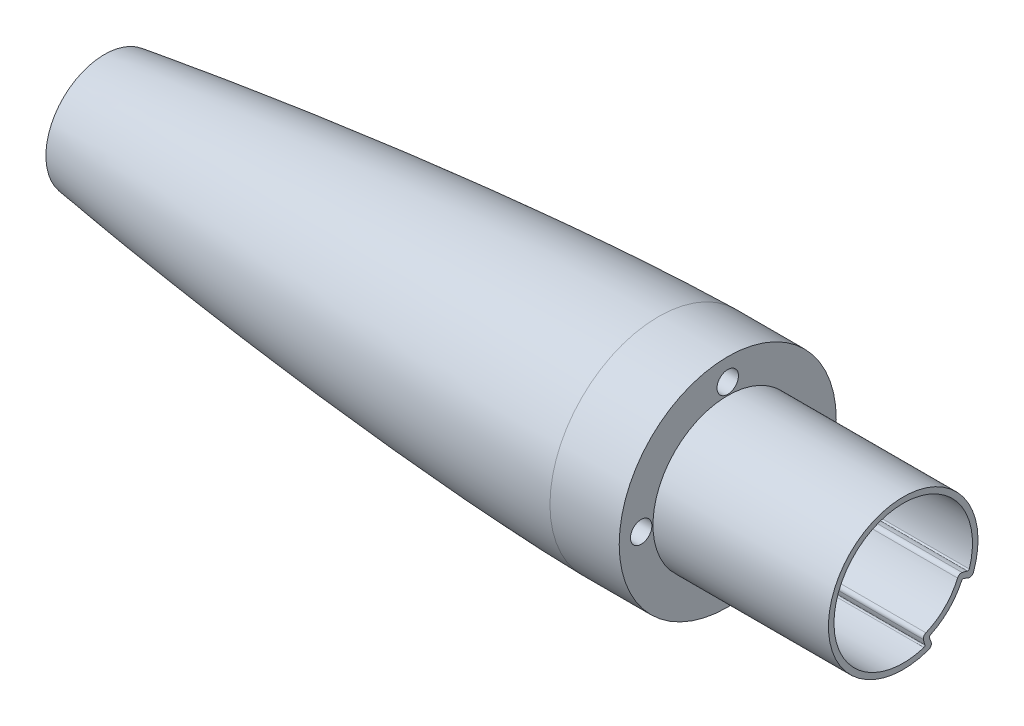
from build123d import *

# Parameters (mm, degrees)
CUT_EXTRUDE1_DEPTH = 400
SKETCH3_R          = 33
SKETCH3_R_2        = 3.1000000000000028
CUT_EXTRUDE2_DEPTH = 40
SKETCH3_2_R        = 3.1000000000000028
CUT_EXTRUDE4_DEPTH = 588.2704126987336
SKETCH4_R          = 7.750000000000002
SKETCH4_R_2        = 7.749999999999998
SKETCH4_R_3        = 7.75
CUT_EXTRUDE5_DEPTH = 30
CUT_EXTRUDE6_START = -166.72
CUT_EXTRUDE6_DEPTH = 166.72
CUT_EXTRUDE7_START = -166.72
CUT_EXTRUDE7_DEPTH = 40
FILLET1_R          = 3
FILLET2_R          = 1


# Read off the part's stored shape, not the designer's step: Cut-Extrude7
with BuildPart() as part:
    # Sketch1 → Revolve1 (revolve)
    with BuildSketch(Plane.XY, mode=Mode.PRIVATE) as revolve1_sk:
        with BuildLine():
            Line((650.0000000000001, 78.36), (600.0000000000001, 78.35999999999999))
            add(Edge.make_bspline(
                [(200.00000000000358, 42.32828037010144), (208.17052038042252, 43.51395402277683), (225.68488706430128, 45.99527814756255), (252.5646252490451, 49.61720291886234), (288.8377795121088, 54.154525537406215), (326.32073414086074, 58.489281573967666), (363.84117713275197, 62.4863121261995), (401.3959942076804, 66.1465092198773), (438.98297125108434, 69.46060873551288), (476.60065297069735, 72.40710938265987), (509.54226569024473, 74.62869781075653), (537.7964811389767, 76.23350465282824), (560.2922621801154, 77.27545940077594), (575.1953567037801, 77.83264328043563), (587.2142250450652, 78.17300672656529), (594.5199761893905, 78.31035588184413), (598.173256760109, 78.35432466011183), (600.0000000000001, 78.35999999999999)],
                knots=[0.33782774337518406, 0.33782774337518406, 0.33782774337518406, 0.33782774337518406, 0.33782774337518406, 0.3922467059008778, 0.45442341660838875, 0.5166001272068571, 0.5787768404127641, 0.6409535517353824, 0.7031302632972144, 0.7653069754242735, 0.8274836869805778, 0.8896603985814769, 0.9207487548355946, 0.9518371110897123, 0.9759185555448562, 0.9879592777724281, 1, 1, 1, 1, 1], degree=4))
            Line((200.0000000000036, 42.32828037010143), (200, -7.43e-14))
            Line((200, 0), (776.72, 0))
            Line((776.72, 0), (776.72, 54))
            Line((776.72, 54), (650.0000000000001, 54))
            Line((650.0000000000001, 54), (650.0000000000001, 78.36))
        make_face()
    revolve(revolve1_sk.sketch.rotate(Axis((776.72, 0, 0), (-1, 0, 0)), 90), axis=Axis((776.72, 0, 0), (-1, 0, 0)))

    # Sketch2 → Cut-Extrude1 (cut)
    with BuildSketch(Plane(origin=(776.72, 0, 0), x_dir=(0, 0, -1), z_dir=(1, 0, 0))):
        with BuildLine():
            ThreePointArc((47.36738574096539, -16.010333165383813), (-35.35533905932756, 35.35533905932719), (16.01033316538431, -47.367385740965226))
            ThreePointArc((16.010333165384957, -47.36738574096489), (14.843408327061695, -43.77194076139418), (14.25549204864172, -40.03786890496388))
            ThreePointArc((14.25549204864269, -40.03786890496403), (30.05203820042843, -30.05203820042811), (40.037868904964185, -14.255492048642266))
            ThreePointArc((40.03786890496402, -14.255492048641287), (43.77194076139434, -14.843408327061226), (47.36738574096508, -16.01033316538445))
        make_face()
    extrude(amount=-CUT_EXTRUDE1_DEPTH, mode=Mode.SUBTRACT)

    # Sketch3 → Cut-Extrude2 (cut)
    with BuildSketch(Plane.ZY.offset(-200.00000000000273)):
        Circle(SKETCH3_R)
        with Locations((0, 20)):
            Circle(SKETCH3_R_2, mode=Mode.SUBTRACT)
        with Locations((0, -20)):
            Circle(SKETCH3_R_2, mode=Mode.SUBTRACT)
    extrude(amount=-CUT_EXTRUDE2_DEPTH, mode=Mode.SUBTRACT)

    # Sketch3<2> → Cut-Extrude4 (cut, through all)
    with BuildSketch(Plane.ZY.offset(-200.00000000000273)):
        with Locations((0, 20)):
            Circle(SKETCH3_2_R)
        with Locations((0, -20)):
            Circle(SKETCH3_2_R)
    extrude(amount=-CUT_EXTRUDE4_DEPTH, mode=Mode.SUBTRACT)

    # Sketch4 → Cut-Extrude5 (cut)
    with BuildSketch(Plane(origin=(650.0000000000001, 0, 0), x_dir=(0, 0, -1), z_dir=(1, 0, 0))):
        with Locations((0, 62.5)):
            Circle(SKETCH4_R)
        with Locations((62.499999999999986, -2.1825e-13)):
            Circle(SKETCH4_R_2)
        with Locations((-4.3715e-13, -62.5)):
            Circle(SKETCH4_R_3)
        with Locations((-62.49999999999999, 6.5573e-13)):
            Circle(SKETCH4_R_2)
    extrude(amount=-CUT_EXTRUDE5_DEPTH, mode=Mode.SUBTRACT)

    # Sketch2<3> → Cut-Extrude6 (cut)
    with BuildSketch(Plane(origin=(776.72, 0, 0), x_dir=(0, 0, -1), z_dir=(1, 0, 0)).offset(CUT_EXTRUDE6_START)):
        with BuildLine():
            ThreePointArc((18.674162122276517, -42.585510083018875), (19.845504593214095, -46.16550545726443), (21.667324002424465, -49.462380356933224))
            ThreePointArc((21.66732400242451, -49.46238035693348), (38.18376618407376, -38.18376618407337), (49.4623803569337, -21.667324002424003))
            ThreePointArc((49.46238035693346, -21.667324002423932), (46.16550545726464, -19.845504593213597), (42.58551008301907, -18.67416212227606))
            ThreePointArc((42.58551008301935, -18.674162122276265), (32.880465325174626, -32.88046532517429), (18.674162122276698, -42.58551008301916))
        make_face()
    extrude(amount=CUT_EXTRUDE6_DEPTH, mode=Mode.SUBTRACT)

    # Cut-Extrude7 outline → Cut-Extrude7 (cut)
    with BuildSketch(Plane(origin=(776.72, 0, 0), x_dir=(0, 0, -1), z_dir=(1, 0, 0)).offset(CUT_EXTRUDE7_START)):
        with BuildLine():
            ThreePointArc((49.462380357, -21.667324002), (38.183766184, -38.183766184), (21.667324002, -49.462380357))
            ThreePointArc((21.667324002, -49.462380357), (52.325901808, -52.325901808), (49.462380357, -21.667324002))
        make_face()
    extrude(amount=CUT_EXTRUDE7_DEPTH, mode=Mode.SUBTRACT)

    # Fillet1
    # the kernel refuses this fillet: 3 mm, written as the material it takes off along each edge
    with BuildSketch(Plane(origin=(783.0040750376627, -40.03786890496436, -14.255492048641756), x_dir=(0, 0.36048933664361255, -0.9327633344885766), z_dir=(-1, 0, 0))) as fillet1_piece_1:
        with BuildLine():
            CenterArc((2.3526530908588352, 2.998927692547355), FILLET1_R, 190.6958961912189, 77.77213613267259)
            ThreePointArc((-0.5952251863106816, 2.4421389866704493), (-0.3296065941102598, 1.2132715607510574), (0, 0))
            ThreePointArc((0, 0), (1.1362245041079626, 0.01519102224578455), (2.2724490082159248, 3e-17))
        make_face()
    extrude(amount=406.28407503766266, mode=Mode.SUBTRACT)
    with BuildSketch(Plane(origin=(783.0040750376628, -14.255492048641326, -40.03786890496452), x_dir=(0, -0.12935906708338796, -0.9915978175466682), z_dir=(-1, 0, 0))) as fillet1_piece_2:
        with BuildLine():
            CenterArc((2.356528139123201, 2.995883676075499), FILLET1_R, 195.22966173823434, 77.77213613267247)
            ThreePointArc((-0.5381137542877349, 2.207817492997983), (-0.25429790806270375, 1.1075059660548925), (0, 0))
            ThreePointArc((0, 0), (1.2568150075323716, -0.0329305913960081), (2.513630015064742, 0))
        make_face()
    extrude(amount=406.2840750376628, mode=Mode.SUBTRACT)
    with BuildSketch(Plane(origin=(650.0000000000001, -49.46238035693335, -21.667324002424486), x_dir=(0, -0.3710376913926641, 0.9286178070476584), z_dir=(1, 0, 0))) as fillet1_piece_3:
        with BuildLine():
            CenterArc((3.4382745469761065, -2.998391169718282), FILLET1_R, 88.12348720794618, 95.23374468145443)
            ThreePointArc((0.4434230907932443, -3.1740748496643687), (0.2853925875390597, -1.5781410862550613), (0, 0))
            ThreePointArc((0, 0), (1.7682554813020526, 0.0289589450709421), (3.5365109626041082, -1.1e-16))
        make_face()
    extrude(amount=135.56127740651016, mode=Mode.SUBTRACT)
    with BuildSketch(Plane(origin=(650.0000000000001, -21.667324002423964, -49.46238035693357), x_dir=(0, 0.9286178070476617, -0.3710376913926558), z_dir=(1, 0, 0))) as fillet1_piece_4:
        with BuildLine():
            CenterArc((3.438274546976126, 2.998391169718279), FILLET1_R, 176.64276811059946, 95.23374468145443)
            ThreePointArc((0.44342309079326614, 3.174074849664362), (0.28539258753907326, 1.5781410862550511), (0, 0))
            ThreePointArc((0, 0), (1.7682554813020637, -0.02895894507093817), (3.53651096260413, 5e-17))
        make_face()
    extrude(amount=135.56127740651016, mode=Mode.SUBTRACT)

    # Fillet2
    fillet2_edges = [part.edges().sort_by_distance(p)[0] for p in [
        (576.72, -47.36738574096506, -16.010333165384637),
        (576.72, -16.01033316538413, -47.36738574096523),
        (693.36, -18.67416212227616, -42.58551008301921),
        (693.36, -42.58551008301902, -18.674162122276606),
    ]]
    fillet(fillet2_edges, radius=FILLET2_R)


solid = part.part
